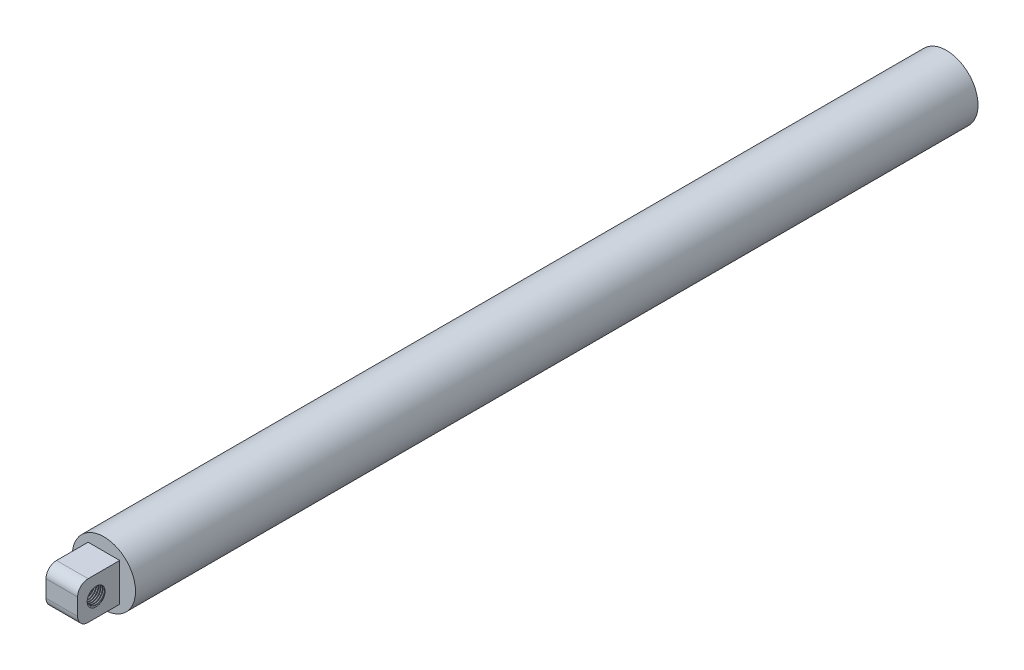
from build123d import *

# Parameters (mm, degrees)
SKETCH2_R           = 15
BOSS_EXTRUDE1_DEPTH = 400
SKETCH3_R           = 5
CUT_EXTRUDE1_DEPTH  = 300
SKETCH4_W           = 15
SKETCH4_H           = 18
BOSS_EXTRUDE2_DEPTH = 20
SKETCH5_R           = 4
CUT_EXTRUDE2_DEPTH  = 15
THREAD1_PITCH       = 1
FILLET1_R           = 5


with BuildPart() as part:
    # Sketch2 → Boss-Extrude1 (new body)
    with BuildSketch(Plane.XY):
        Circle(SKETCH2_R)
    extrude(amount=BOSS_EXTRUDE1_DEPTH)

    # Sketch3 → Cut-Extrude1 (cut)
    with BuildSketch(Plane(origin=(0, 0, 0), x_dir=(-1, 0, 0), z_dir=(0, 0, -1))):
        Circle(SKETCH3_R)
    extrude(amount=-CUT_EXTRUDE1_DEPTH, mode=Mode.SUBTRACT)

    # Sketch4 → Boss-Extrude2 (add)
    with BuildSketch(Plane.XY.offset(400)):
        Rectangle(SKETCH4_W, SKETCH4_H)
    extrude(amount=BOSS_EXTRUDE2_DEPTH)

    # Sketch5 → Cut-Extrude2 (cut)
    with BuildSketch(Plane(origin=(7.5, 0, 0), x_dir=(0, 0, -1), z_dir=(1, 0, 0))):
        with Locations(Location((-411, 0, 0), (0, 0, 90))):
            Circle(SKETCH5_R)
    extrude(amount=-CUT_EXTRUDE2_DEPTH, mode=Mode.SUBTRACT)

    # Thread1: the profile of Thread Profile1 profile screwed along a right-hand helix of 15 turns, 8 arcs to a turn; built about Z, then put on its axis
    thread1_z = Axis((0, 0, 0), (0, 0, 1))
    thread1_corners = [(3.9997, 0, -0.000173205), (4.541265875, 0, 0.312499999), (4.541265875, 0, 0.437499999), (3.9997, 0, 0.750173202)]
    with BuildLine(mode=Mode.PRIVATE) as thread1_profile:
        Line(thread1_corners[0], thread1_corners[1])
        Line(thread1_corners[1], thread1_corners[2])
        Line(thread1_corners[2], thread1_corners[3])
        Line(thread1_corners[3], thread1_corners[0])
    thread1_cap = Face(thread1_profile.wire())
    thread1_turn_angles = [0, 22.5, 45, 67.5, 90, 112.5, 135, 157.5, 180, 202.5, 225, 247.5, 270, 292.5, 315, 337.5, 360]
    thread1_turn_weights = [1, 0.9238795325112867, 1, 0.9238795325112867, 1, 0.9238795325112867, 1, 0.9238795325112867, 1, 0.9238795325112867, 1, 0.9238795325112867, 1, 0.9238795325112867, 1, 0.9238795325112867, 1]
    thread1_turn_rails = [Edge.make_bspline([Vector(p[0], p[1], 0).rotate(thread1_z, thread1_turn_angles[k]) / thread1_turn_weights[k] + Vector(0, 0, p[2] + THREAD1_PITCH * thread1_turn_angles[k] / 360) for k in range(17)], [0, 0, 0, 1, 1, 2, 2, 3, 3, 4, 4, 5, 5, 6, 6, 7, 7, 8, 8, 8], 2, thread1_turn_weights) for p in thread1_corners]
    thread1_turn_sides = [Face.make_surface_from_curves(thread1_turn_rails[p[0]], thread1_turn_rails[p[1]]) for p in [(0, 1), (1, 2), (2, 3), (3, 0)]]
    thread1 = Plane(origin=(-7.5, 0, 411), x_dir=(0, 0, -1), z_dir=(1, 0, 0)) * Solid(Shell([*[p.moved(Location((0, 0, THREAD1_PITCH * i))) for i in range(15) for p in thread1_turn_sides], thread1_cap, thread1_cap.rotate(thread1_z, 5400).moved(Location((0, 0, THREAD1_PITCH * 5400 / 360)))]))
    add(thread1, mode=Mode.SUBTRACT)

    # Fillet1
    fillet1_edges = [part.edges().sort_by_distance(p)[0] for p in [
        (0, 9, 420),
        (0, -9, 420),
    ]]
    fillet(fillet1_edges, radius=FILLET1_R)


solid = part.part
